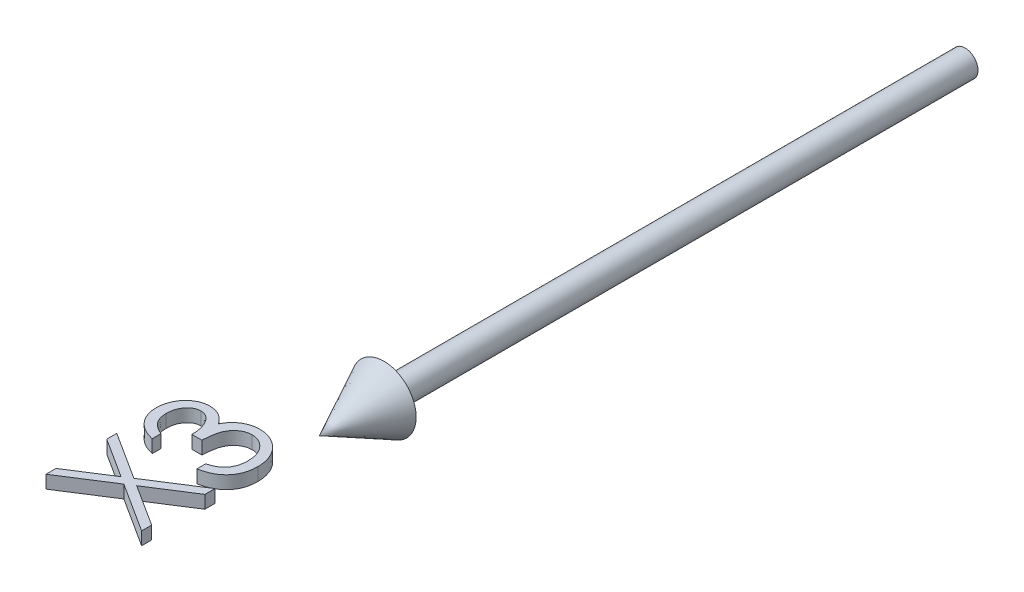
from build123d import *

# Parameters (mm, degrees)
BOSS_EXTRUDE1_DEPTH        = 1
BOSS_EXTRUDE1_DEPTH_BACK   = 1
BOSS_EXTRUDE1_2_DEPTH      = 1
BOSS_EXTRUDE1_2_DEPTH_BACK = 1


with BuildPart() as part:
    # Sketch2 → Revolve1 (revolve)
    with BuildSketch(Plane(origin=(0, 0, 0), x_dir=(1, 0, 0), z_dir=(0, 1, 0))):
        Polygon((0, -100), (5, -90), (2, -90), (2, 0), (0, 0), align=None)
    revolve(axis=Axis((0, 0, -41.949952025), (0, 0, 1)))


with BuildPart() as body_2:
    # Sketch3 → Boss-Extrude1 (new, two sides: drawn at the far end of the back side and taken through both)
    with BuildSketch(Plane(origin=(0, 0, 0), x_dir=(1, 0, 0), z_dir=(0, 1, 0)).offset(-BOSS_EXTRUDE1_DEPTH_BACK)):
        with BuildLine():
            Line((-11.538461538, -112.991265497), (-11.538461538, -114.337419343))
            add(Edge.make_bspline(
                [(-11.538461538, -114.337419343), (-11.689457898, -114.30094984), (-11.984643431, -114.229654945), (-12.406388835, -114.080951059), (-12.805489641, -113.918954251), (-13.174472814, -113.724429517), (-13.520753826, -113.512249142), (-13.836478645, -113.269151764), (-14.129677068, -113.006352953), (-14.389876658, -112.715674598), (-14.625495497, -112.410837477), (-14.8263886, -112.08754625), (-14.999206398, -111.752305277), (-15.141578821, -111.40279185), (-15.248831065, -111.0379654), (-15.326645946, -110.661124157), (-15.377179293, -110.271280585), (-15.382111134, -110.006648054), (-15.384615385, -109.872275112)],
                knots=[0, 0, 0, 0, 1.162005537, 2.271625781, 3.343758855, 4.383309926, 5.390229558, 6.379919256, 7.361854164, 8.333198761, 9.295911338, 10.242430842, 11.177959212, 12.116337295, 13.062827104, 14.020064771, 14.994644689, 16, 16, 16, 16], degree=3))
            add(Edge.make_bspline(
                [(-15.384615385, -109.872275112), (-15.378704398, -109.676491932), (-15.36701136, -109.289196171), (-15.260235204, -108.720211684), (-15.091270351, -108.171525316), (-14.85781152, -107.649142826), (-14.569865892, -107.163920972), (-14.227159877, -106.732194457), (-13.836305728, -106.359815125), (-13.404594738, -106.047410649), (-12.943213983, -105.802803511), (-12.468356167, -105.622433339), (-11.981147718, -105.512626134), (-11.65218795, -105.498395176), (-11.487379808, -105.491265497)],
                knots=[0, 0, 0, 0, 1.083050992, 2.142477498, 3.193116406, 4.255571735, 5.30263384, 6.308962982, 7.297363603, 8.282367274, 9.249857812, 10.179914175, 11.08814088, 12, 12, 12, 12], degree=3))
            add(Edge.make_bspline(
                [(-11.487379808, -105.491265497), (-11.328779259, -105.496252316), (-11.018422597, -105.506010746), (-10.565330466, -105.588869484), (-10.138295037, -105.728310611), (-9.735518627, -105.921466736), (-9.359555028, -106.171501952), (-9.009558353, -106.474384938), (-8.683976247, -106.832253489), (-8.49746422, -107.103448937), (-8.401442308, -107.243068382)],
                knots=[0, 0, 0, 0, 1.024540389, 2.004866551, 2.965041327, 3.920577974, 4.882998113, 5.874504559, 6.905732034, 8, 8, 8, 8], degree=3))
            add(Edge.make_bspline(
                [(-8.401442308, -107.243068382), (-8.324672319, -107.083300333), (-8.172322261, -106.766240609), (-7.868793148, -106.338434513), (-7.526944029, -105.944155286), (-7.257191084, -105.726857646), (-7.121394231, -105.61746742)],
                knots=[0, 0, 0, 0, 1.015663554, 2.015584519, 3.001021554, 4, 4, 4, 4], degree=3))
            add(Edge.make_bspline(
                [(-7.121394231, -105.61746742), (-7.022575295, -105.545290239), (-6.826555653, -105.402117827), (-6.511399542, -105.225394111), (-6.192750302, -105.065069335), (-5.862067133, -104.940139824), (-5.523182789, -104.84339468), (-5.175515377, -104.774240256), (-4.818780996, -104.731279653), (-4.577441795, -104.725127287), (-4.456129808, -104.722034728)],
                knots=[0, 0, 0, 0, 1.025084078, 2.033381695, 3.024893161, 4.013698104, 4.991890475, 5.976764909, 6.982997093, 8, 8, 8, 8], degree=3))
            add(Edge.make_bspline(
                [(-4.456129808, -104.722034728), (-4.246089219, -104.729726608), (-3.826996497, -104.745074171), (-3.207803012, -104.882217864), (-2.602613657, -105.094910862), (-2.023479045, -105.396618893), (-1.482141234, -105.76597949), (-0.994212159, -106.200548469), (-0.581382488, -106.706538529), (-0.232273507, -107.265611711), (0.044193129, -107.873921501), (0.243460232, -108.521899836), (0.362980472, -109.205796782), (0.37732164, -109.673479717), (0.384615385, -109.911337612)],
                knots=[0, 0, 0, 0, 0.955697303, 1.906897079, 2.875188111, 3.870982192, 4.871999088, 5.854111427, 6.836107184, 7.836239895, 8.848948182, 9.870701427, 10.917064451, 12, 12, 12, 12], degree=3))
            add(Edge.make_bspline(
                [(0.384615385, -109.911337612), (0.380862016, -110.071695948), (0.37347664, -110.387227678), (0.323887695, -110.851272149), (0.23085521, -111.293285652), (0.113853984, -111.717560314), (-0.047913319, -112.117692799), (-0.240769913, -112.499438638), (-0.469661352, -112.861124509), (-0.734972564, -113.200602474), (-1.031948792, -113.517509847), (-1.365523642, -113.803772877), (-1.72947145, -114.06255876), (-2.127065987, -114.292223204), (-2.557193647, -114.493732776), (-3.02157803, -114.662750975), (-3.516619024, -114.810324741), (-3.861508239, -114.879070722), (-4.038461538, -114.91434242)],
                knots=[0, 0, 0, 0, 1.048603596, 2.063302207, 3.045874044, 3.999447474, 4.937100059, 5.862643889, 6.7929026, 7.7308982, 8.676022965, 9.627908155, 10.600123445, 11.591992905, 12.626222643, 13.701663232, 14.820785756, 16, 16, 16, 16], degree=3))
            Line((-4.038461538, -114.91434242), (-4.038461538, -113.568188574))
            add(Edge.make_bspline(
                [(-4.038461538, -113.568188574), (-3.922965767, -113.533117325), (-3.69831646, -113.464900699), (-3.375000865, -113.348782279), (-3.078609208, -113.216489684), (-2.806967257, -113.074570147), (-2.557399817, -112.925519664), (-2.336506093, -112.758741414), (-2.134583798, -112.586587935), (-2.020821175, -112.456819277), (-1.965144231, -112.393308766)],
                knots=[0, 0, 0, 0, 1.198163088, 2.33053128, 3.407730985, 4.417276592, 5.372219308, 6.28897303, 7.162600585, 8, 8, 8, 8], degree=3))
            add(Edge.make_bspline(
                [(-1.965144231, -112.393308766), (-1.900420928, -112.309314058), (-1.771174108, -112.141583913), (-1.605766423, -111.868432278), (-1.464181399, -111.580155342), (-1.349095157, -111.274349079), (-1.262707273, -110.950972465), (-1.20052934, -110.611337254), (-1.159482243, -110.254886188), (-1.155752252, -110.0116153), (-1.153846154, -109.887299151)],
                knots=[0, 0, 0, 0, 0.946083416, 1.889246487, 2.84504177, 3.809995578, 4.801312957, 5.829064617, 6.89060985, 8, 8, 8, 8], degree=3))
            add(Edge.make_bspline(
                [(-1.153846154, -109.887299151), (-1.156485748, -109.746926997), (-1.161647246, -109.472441367), (-1.209114561, -109.071920541), (-1.278244904, -108.690888623), (-1.385014831, -108.333576084), (-1.516932765, -107.995302481), (-1.682568789, -107.680809697), (-1.87690331, -107.385969242), (-2.097785418, -107.114557504), (-2.339591826, -106.870505329), (-2.592504988, -106.655621701), (-2.855458543, -106.472944581), (-3.129907633, -106.325586388), (-3.414715756, -106.209226887), (-3.710682168, -106.13001317), (-4.015384737, -106.074935248), (-4.22250889, -106.070449768), (-4.326923077, -106.068188574)],
                knots=[0, 0, 0, 0, 1.217147791, 2.380027433, 3.494444702, 4.572153297, 5.609568379, 6.639424714, 7.649109417, 8.668170816, 9.669597737, 10.625200337, 11.543417969, 12.441394052, 13.322311151, 14.205496177, 15.095365482, 16, 16, 16, 16], degree=3))
            add(Edge.make_bspline(
                [(-4.326923077, -106.068188574), (-4.466677019, -106.07476081), (-4.745489506, -106.087872579), (-5.155841572, -106.187559781), (-5.5513555, -106.353007129), (-5.926908684, -106.580086751), (-6.270731039, -106.863272255), (-6.579696009, -107.189174955), (-6.834396625, -107.566661074), (-7.010533834, -107.913833297), (-7.130686512, -108.221406324), (-7.210723541, -108.48461321), (-7.278495903, -108.779284949), (-7.341548633, -109.101854837), (-7.395211512, -109.45475439), (-7.439962163, -109.837599108), (-7.475769478, -110.250466663), (-7.491759887, -110.536285944), (-7.5, -110.683573189)],
                knots=[0, 0, 0, 0, 1.070505987, 2.135685285, 3.216438728, 4.346150463, 5.486482244, 6.621737109, 7.7759408, 8.963942283, 9.59839197, 10.305095457, 11.070459627, 11.915156775, 12.823989992, 13.805807174, 14.869297358, 16, 16, 16, 16], degree=3))
            Line((-7.5, -110.683573189), (-9.038461538, -110.683573189))
            add(Edge.make_bspline(
                [(-9.038461538, -110.683573189), (-9.042064611, -110.498063828), (-9.049119676, -110.134823627), (-9.117326452, -109.602817637), (-9.226825148, -109.09625205), (-9.383279881, -108.622408875), (-9.567564659, -108.19135177), (-9.780500635, -107.815872909), (-10.021509768, -107.505856925), (-10.28597768, -107.258064984), (-10.56808108, -107.069725701), (-10.863907269, -106.934277534), (-11.174628999, -106.853550307), (-11.386761814, -106.842815264), (-11.493389423, -106.837419343)],
                knots=[0, 0, 0, 0, 1.322091412, 2.58874672, 3.817242262, 5.011895168, 6.140903042, 7.155122731, 8.080855046, 8.929742606, 9.727943956, 10.488587771, 11.240295418, 12, 12, 12, 12], degree=3))
            add(Edge.make_bspline(
                [(-11.493389423, -106.837419343), (-11.571735651, -106.839156521), (-11.727601755, -106.842612554), (-11.956033083, -106.88792988), (-12.177471239, -106.952897065), (-12.389391452, -107.047221607), (-12.592227451, -107.169433643), (-12.788204331, -107.316845373), (-12.9747898, -107.493658083), (-13.152946463, -107.691690234), (-13.315019721, -107.910976433), (-13.456860642, -108.14640149), (-13.57718553, -108.397010777), (-13.676736425, -108.66119897), (-13.751539479, -108.940197211), (-13.805270808, -109.232591871), (-13.838859005, -109.538969013), (-13.843695316, -109.747990534), (-13.846153846, -109.854246266)],
                knots=[0, 0, 0, 0, 0.884325644, 1.759323928, 2.622595547, 3.489424008, 4.37295195, 5.294616785, 6.255907374, 7.274251867, 8.302369084, 9.333474657, 10.37669385, 11.44084034, 12.520297356, 13.637342342, 14.798947025, 16, 16, 16, 16], degree=3))
            add(Edge.make_bspline(
                [(-13.846153846, -109.854246266), (-13.840190866, -110.025039129), (-13.828543779, -110.358637314), (-13.726530865, -110.839558386), (-13.56376765, -111.286641246), (-13.369483281, -111.628378389), (-13.177695707, -111.880732278), (-13.010199765, -112.061062013), (-12.824059092, -112.238149915), (-12.607808913, -112.400345673), (-12.376094098, -112.564377001), (-12.117135462, -112.713710836), (-11.837688058, -112.858823803), (-11.640135339, -112.946263302), (-11.538461538, -112.991265497)],
                knots=[0, 0, 0, 0, 1.472543308, 2.876219568, 4.221790263, 5.565193594, 6.249813518, 6.953379497, 7.687249741, 8.463570142, 9.283606569, 10.136032583, 11.040678096, 12, 12, 12, 12], degree=3))
        make_face()
    extrude(amount=BOSS_EXTRUDE1_DEPTH + BOSS_EXTRUDE1_DEPTH_BACK)


with BuildPart() as body_3:
    # Sketch3 → Boss-Extrude1 2 (new, two sides: drawn at the far end of the back side and taken through both)
    with BuildSketch(Plane(origin=(0, 0, 0), x_dir=(1, 0, 0), z_dir=(0, 1, 0)).offset(-BOSS_EXTRUDE1_2_DEPTH_BACK)):
        Polygon((-15, -127.318188574), (-15, -125.764702997), (-8.864182692, -121.837419343), (-15, -117.910135689), (-15, -116.356650112), (-7.650240385, -121.059174151), (0, -116.16434242), (0, -117.717827997), (-6.436298077, -121.837419343), (0, -125.957010689), (0, -127.510496266), (-7.650240385, -122.612659728), align=None)
    extrude(amount=BOSS_EXTRUDE1_2_DEPTH + BOSS_EXTRUDE1_2_DEPTH_BACK)


solid = Compound([part.part, body_2.part, body_3.part])
